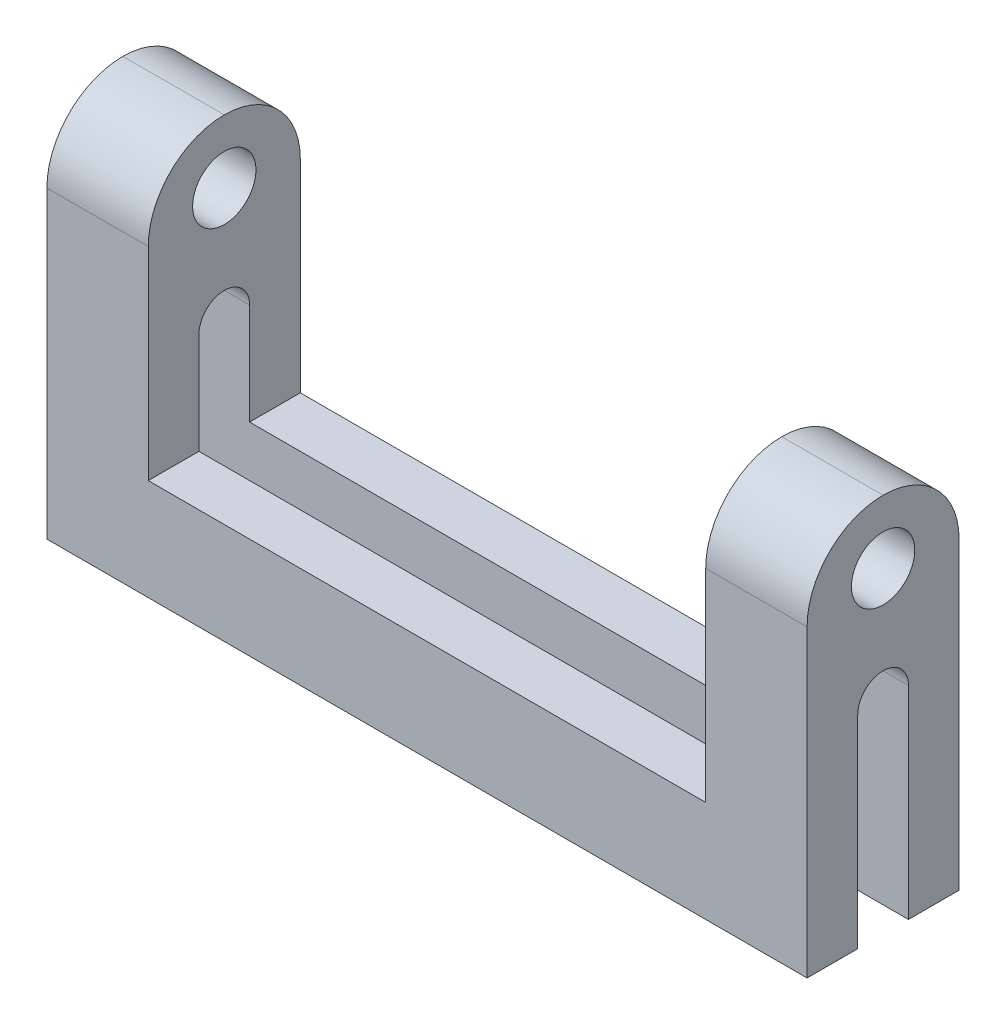
from build123d import *

# Parameters (mm, degrees)
SKETCH1_W           = 60
SKETCH1_H           = 12
BOSS_EXTRUDE1_DEPTH = 8
SKETCH2_W           = 8
SKETCH2_H           = 12
BOSS_EXTRUDE2_DEPTH = 22
SKETCH3_R           = 2.5
CUT_EXTRUDE1_DEPTH  = 68.349832962
FILLET1_R           = 6
SKETCH5_W           = 60
SKETCH5_H           = 4
CUT_EXTRUDE2_DEPTH  = 18
FILLET2_R           = 2


with BuildPart() as part:
    # Sketch1 → Boss-Extrude1 (new body)
    with BuildSketch(Plane(origin=(0, 0, 0), x_dir=(1, 0, 0), z_dir=(0, 1, 0))):
        Rectangle(SKETCH1_W, SKETCH1_H)
    extrude(amount=BOSS_EXTRUDE1_DEPTH)

    # Sketch2 → Boss-Extrude2 (add)
    with BuildSketch(Plane(origin=(0, 8, 0), x_dir=(1, 0, 0), z_dir=(0, 1, 0))):
        with Locations((-26, 0)):
            Rectangle(SKETCH2_W, SKETCH2_H)
        with Locations((26, 0)):
            Rectangle(SKETCH2_W, SKETCH2_H)
    extrude(amount=BOSS_EXTRUDE2_DEPTH)

    # Sketch3 → Cut-Extrude1 (cut, through all)
    with BuildSketch(Plane.ZY.offset(30)):
        with Locations((0, 25)):
            Circle(SKETCH3_R)
    extrude(amount=-CUT_EXTRUDE1_DEPTH, mode=Mode.SUBTRACT)

    # Fillet1
    fillet1_edges = [part.edges().sort_by_distance(p)[0] for p in [
        (-26, 30, 6),
        (26, 30, 6),
        (26, 30, -6),
        (-26, 30, -6),
    ]]
    fillet(fillet1_edges, radius=FILLET1_R - 0.0001)  # a hair under: the kernel refuses the full size

    # Sketch5 → Cut-Extrude2 (cut)
    with BuildSketch(Plane.XZ):
        Rectangle(SKETCH5_W, SKETCH5_H)
    extrude(amount=-CUT_EXTRUDE2_DEPTH, mode=Mode.SUBTRACT)

    # Fillet2
    fillet2_edges = [part.edges().sort_by_distance(p)[0] for p in [
        (-26, 18, 2),
        (-26, 18, -2),
        (26, 18, -2),
        (26, 18, 2),
    ]]
    fillet(fillet2_edges, radius=FILLET2_R - 0.0001)  # a hair under: the kernel refuses the full size


solid = part.part
